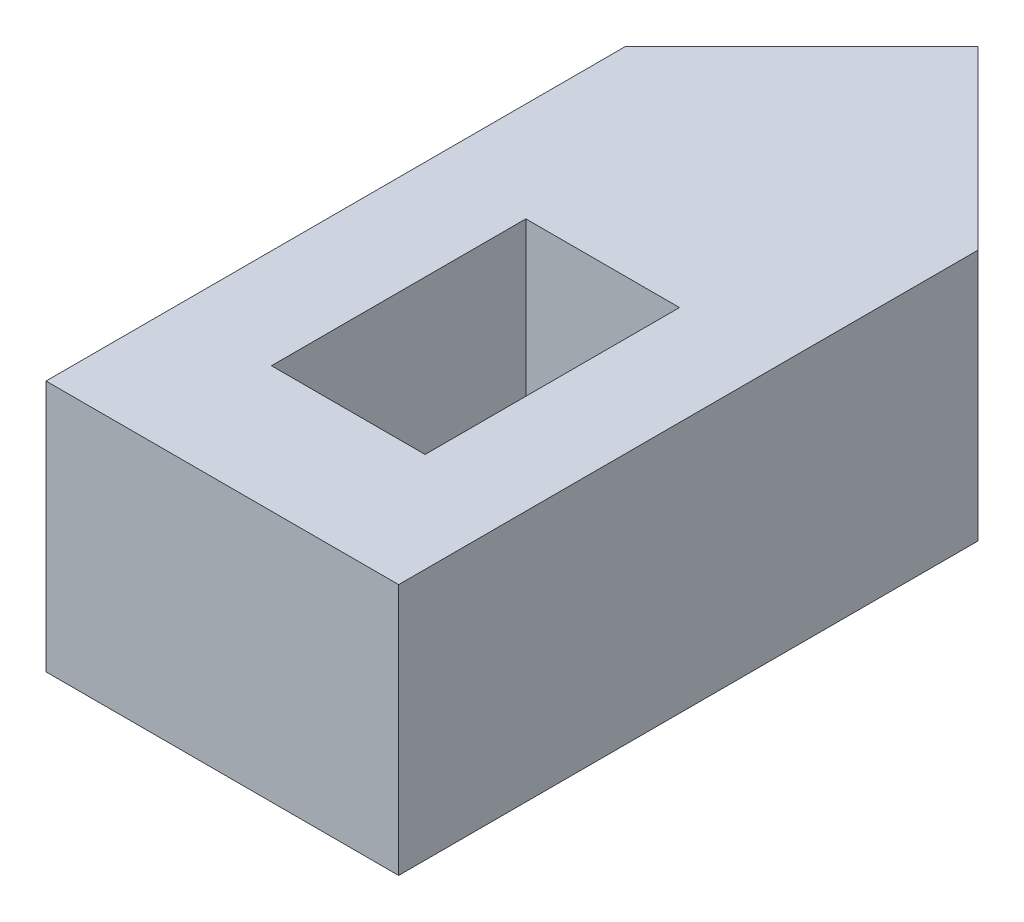
from build123d import *

# Parameters (mm, degrees)
SKETCH2_W           = 7
SKETCH2_H           = 15
SKETCH2_W_2         = 3.05
SKETCH2_H_2         = 5.05
BOSS_EXTRUDE1_DEPTH = 5
CHAMFER1_SIZE       = 3.5


with BuildPart() as part:
    # Sketch2 → Boss-Extrude1 (new body)
    with BuildSketch(Plane(origin=(0, 0, 0), x_dir=(1, 0, 0), z_dir=(0, 1, 0))):
        with Locations((3.5, 7.5)):
            Rectangle(SKETCH2_W, SKETCH2_H)
        with Locations((3.5, 5.025)):
            Rectangle(SKETCH2_W_2, SKETCH2_H_2, mode=Mode.SUBTRACT)
    extrude(amount=BOSS_EXTRUDE1_DEPTH)

    # Chamfer1
    chamfer1_edges = [part.edges().sort_by_distance(p)[0] for p in [
        (0, 2.5, -15),
        (7, 2.5, -15),
    ]]
    chamfer(chamfer1_edges, length=CHAMFER1_SIZE - 0.0001)  # a hair under: the kernel refuses the full size


solid = part.part
